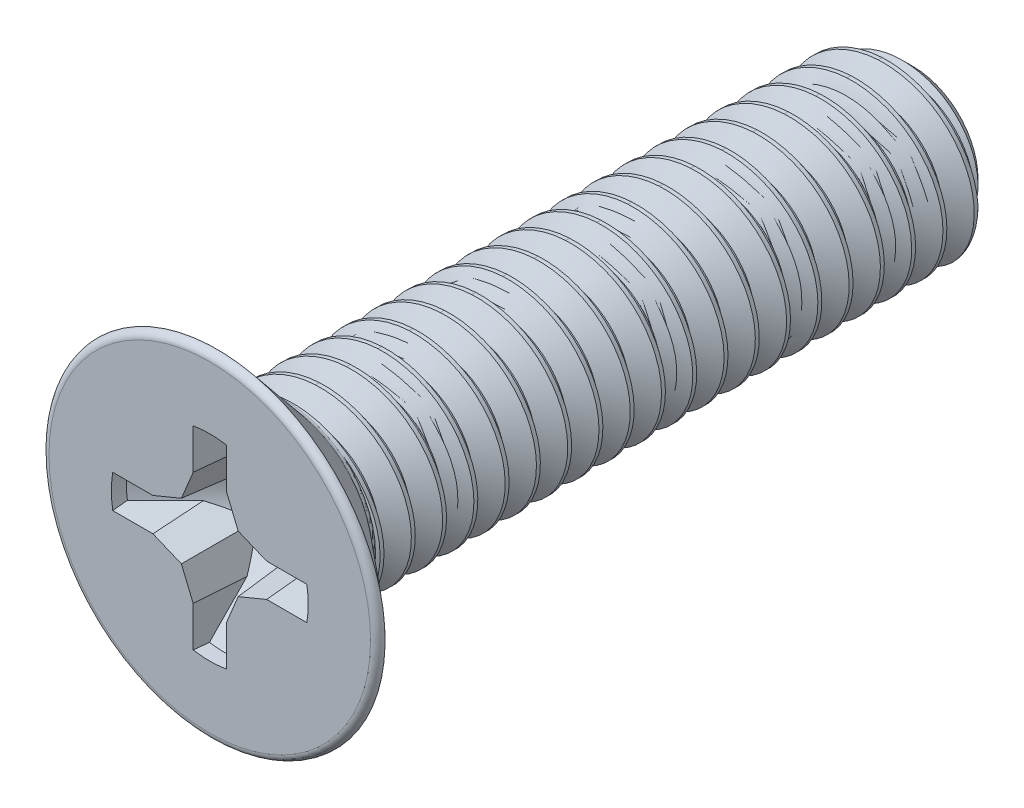
from build123d import *

# Parameters (mm, degrees)
SKETCH8_R          = 2.519891667
CUT_EXTRUDE2_DEPTH = 0.127
CUT_EXTRUDE2_DRAFT = -10
CUT_EXTRUDE1_REACH = 35.512
CIRPATTERN1_COUNT  = 4
DRAFT2_ANGLE       = 5
FILLET1_R          = 0.24844375
FILLET2_R          = 0.325326375
CUT_SWEEP1_PITCH   = 1.411111111
CUT_SWEEP1_TO      = 28.2448


with BuildPart() as part:
    # Sketch3 → Revolve1 (revolve)
    with BuildSketch(Plane(origin=(0, 0, 0), x_dir=(0, 0, -1), z_dir=(1, 0, 0)), mode=Mode.PRIVATE) as revolve1_sk:
        Polygon((-3.5052, 7.5819), (-3.5052, 0), (-0.15012295, 0), (-0.15012295, 3.9751), (-3.1765875, 7.5819), align=None)
    revolve(revolve1_sk.sketch.rotate(Axis((0, 0, 3.5052), (0, 0, -1)), 180), axis=Axis((0, 0, 3.5052), (0, 0, -1)))

    # Sketch5 → Revolve2 (revolve)
    with BuildSketch(Plane(origin=(0, 0, 0), x_dir=(0, 0, -1), z_dir=(1, 0, 0))):
        Polygon((28.2448, 0), (-0.15012295, 0), (-0.15012295, 3.9751), (27.186466667, 3.9751), (28.2448, 2.916766667), align=None)
    revolve(axis=Axis((0, 0, -28.2448), (0, 0, 1)))


with BuildPart() as cut_extrude2_tool:
    # Sketch8 → Cut-Extrude2 (with draft: the straight prism first)
    with BuildSketch(Plane(origin=(0, 0, -28.2448), x_dir=(-1, 0, 0), z_dir=(0, 0, -1))):
        Circle(SKETCH8_R)
    extrude(amount=-CUT_EXTRUDE2_DEPTH)
    # Cut-Extrude2: the draft: its side faces are tilted about the plane it starts from
    cut_extrude2_sides = [cut_extrude2_tool.faces().sort_by_distance(p)[0] for p in [
        (2.519891667, 0, -28.1813),
    ]]
    draft(cut_extrude2_sides, Plane(origin=(0, 0, -28.2448), x_dir=(-1, 0, 0), z_dir=(0, 0, -1)), CUT_EXTRUDE2_DRAFT)


with BuildPart() as part_1:
    add(part.part)

    # Cut-Extrude2: cut by cut_extrude2_tool
    add(cut_extrude2_tool.part, mode=Mode.SUBTRACT)

    # Cut-Extrude1: up to this cone (the profile starts inside it)
    cut_extrude1_end = Plane(origin=(0, 0, 3.5052), z_dir=(0, 0, 1)).offset(-4.402724178) * Cone(1.192e-06, 54.417481584, 45.661687727, align=(Align.CENTER, Align.CENTER, Align.MIN), mode=Mode.PRIVATE)
    # Sketch4 → Cut-Extrude1 (cut, up to the surface)
    with BuildSketch(Plane.XY.offset(3.5052), mode=Mode.PRIVATE) as cut_extrude1_sk1:
        with BuildLine():
            Line((0, 0), (4.445, 0))
            ThreePointArc((4.445, 0), (4.429068842, 0.375997599), (4.381389564, 0.7493))
            Line((4.381389564, 0.7493), (2.565344782, 0.7493))
            Line((2.565344782, 0.7493), (1.281207202, 1.281207202))
            Line((1.281207202, 1.281207202), (0.7493, 2.565344782))
            Line((0.7493, 2.565344782), (0.7493, 4.381389564))
            ThreePointArc((0.7493, 4.381389564), (0.375997599, 4.429068842), (0, 4.445))
            Line((0, 4.445), (0, 0))
        make_face()
    cut_extrude1_tool1 = extrude(cut_extrude1_sk1.sketch, amount=-CUT_EXTRUDE1_REACH, mode=Mode.PRIVATE) & cut_extrude1_end
    cut_extrude1 = cut_extrude1_tool1.solids().sort_by_distance((0.062862, 2.2225, 3.5052))[0]
    add(cut_extrude1, mode=Mode.SUBTRACT)

    # CirPattern1: Cut-Extrude1 ×4 about axis
    cirpattern1_axis = Axis((0, 0, 0), (0, 0, 1))
    for i in range(1, CIRPATTERN1_COUNT):
        add(cut_extrude1.rotate(cirpattern1_axis, i * 360 / CIRPATTERN1_COUNT), mode=Mode.SUBTRACT)

    # Draft2
    draft2_faces = [part_1.faces().sort_by_distance(p)[0] for p in [
        (-3.314723686, 0.7493, 2.730357163),
        (-1.892705762, 1.027916205, 2.216854354),
        (-1.027916205, 1.892705762, 2.216854354),
        (-0.7493, 3.314723686, 2.730357163),
        (0.7493, 3.314723686, 2.730357163),
        (1.027916205, 1.892705762, 2.216854354),
        (1.892705762, 1.027916205, 2.216854354),
        (3.314723686, 0.7493, 2.730357163),
        (3.314723686, -0.7493, 2.730357163),
        (1.892705762, -1.027916205, 2.216854354),
        (1.027916205, -1.892705762, 2.216854354),
        (0.7493, -3.314723686, 2.730357163),
        (-0.7493, -3.314723686, 2.730357163),
        (-1.027916205, -1.892705762, 2.216854354),
        (-1.892705762, -1.027916205, 2.216854354),
        (-3.314723686, -0.7493, 2.730357163),
    ]]
    draft(draft2_faces, Plane(origin=(0, 0, 3.5052), x_dir=(0, 1, 0), z_dir=(0, 0, 1)), DRAFT2_ANGLE)

    # Fillet1
    fillet1_edges = [part_1.edges().sort_by_distance(p)[0] for p in [
        (3.9751, 0, 0.15012295),
    ]]
    fillet(fillet1_edges, radius=FILLET1_R)

    # Fillet2
    fillet2_edges = [part_1.edges().sort_by_distance(p)[0] for p in [
        (0, 7.5819, 3.5052),
    ]]
    fillet(fillet2_edges, radius=FILLET2_R)


with BuildPart() as body_2:
    # Split1: the piece on the far side of the plane
    add(part_1.part)
    split(bisect_by=Plane(origin=(0, 0, 0), x_dir=(0, -1, 0), z_dir=(0, 0, -1)), keep=Keep.BOTTOM)


with BuildPart() as part_2:
    add(part_1.part)

    # Split1
    split(bisect_by=Plane(origin=(0, 0, 0), x_dir=(0, -1, 0), z_dir=(0, 0, -1)), keep=Keep.TOP)

    # Cut-Sweep1: arcs per turn and ends read off the stored shape
    # Cut-Sweep1: the profile of Sketch7 screwed along a right-hand helix through 22.5 turns, 8 arcs to a turn; built about Z, then put on its axis
    cut_sweep1_z = Axis((0, 0, 0), (0, 0, 1))
    cut_sweep1_corners = [(3.058556448, 0, -0.705555556), (3.058556448, 0, -0.529166667), (4.051478629, 0, 0.044097222), (4.051478629, 0, -1.278819444)]
    with BuildLine(mode=Mode.PRIVATE) as cut_sweep1_profile:
        Line(cut_sweep1_corners[0], cut_sweep1_corners[1])
        Line(cut_sweep1_corners[1], cut_sweep1_corners[2])
        Line(cut_sweep1_corners[2], cut_sweep1_corners[3])
        Line(cut_sweep1_corners[3], cut_sweep1_corners[0])
    cut_sweep1_cap = Face(cut_sweep1_profile.wire())
    cut_sweep1_turn_angles = [0, 22.5, 45, 67.5, 90, 112.5, 135, 157.5, 180, 202.5, 225, 247.5, 270, 292.5, 315, 337.5, 360]
    cut_sweep1_turn_weights = [1, 0.9238795325112867, 1, 0.9238795325112867, 1, 0.9238795325112867, 1, 0.9238795325112867, 1, 0.9238795325112867, 1, 0.9238795325112867, 1, 0.9238795325112867, 1, 0.9238795325112867, 1]
    cut_sweep1_turn_rails = [Edge.make_bspline([Vector(p[0], p[1], 0).rotate(cut_sweep1_z, cut_sweep1_turn_angles[k]) / cut_sweep1_turn_weights[k] + Vector(0, 0, p[2] + CUT_SWEEP1_PITCH * cut_sweep1_turn_angles[k] / 360) for k in range(17)], [0, 0, 0, 1, 1, 2, 2, 3, 3, 4, 4, 5, 5, 6, 6, 7, 7, 8, 8, 8], 2, cut_sweep1_turn_weights) for p in cut_sweep1_corners]
    cut_sweep1_turn_sides = [Face.make_surface_from_curves(cut_sweep1_turn_rails[p[0]], cut_sweep1_turn_rails[p[1]]) for p in [(0, 1), (1, 2), (2, 3), (3, 0)]]
    cut_sweep1_last_angles = [7920, 7942.5, 7965, 7987.5, 8010, 8032.5, 8055, 8077.5, 8100]
    cut_sweep1_last_weights = [1, 0.9238795325112867, 1, 0.9238795325112867, 1, 0.9238795325112867, 1, 0.9238795325117363, 1]
    cut_sweep1_last_rails = [Edge.make_bspline([Vector(p[0], p[1], 0).rotate(cut_sweep1_z, cut_sweep1_last_angles[k]) / cut_sweep1_last_weights[k] + Vector(0, 0, p[2] + CUT_SWEEP1_PITCH * cut_sweep1_last_angles[k] / 360) for k in range(9)], [0, 0, 0, 1, 1, 2, 2, 3, 3, 4, 4, 4], 2, cut_sweep1_last_weights) for p in cut_sweep1_corners]
    cut_sweep1_last_sides = [Face.make_surface_from_curves(cut_sweep1_last_rails[p[0]], cut_sweep1_last_rails[p[1]]) for p in [(0, 1), (1, 2), (2, 3), (3, 0)]]
    cut_sweep1 = Plane(origin=(0, 0, -28.2448), x_dir=(0, 1, 0), z_dir=(0, 0, 1)) * split(Solid(Shell([*[p.moved(Location((0, 0, CUT_SWEEP1_PITCH * i))) for i in range(22) for p in cut_sweep1_turn_sides], *cut_sweep1_last_sides, cut_sweep1_cap, cut_sweep1_cap.rotate(cut_sweep1_z, 8100).moved(Location((0, 0, CUT_SWEEP1_PITCH * 8100 / 360)))])), bisect_by=Plane.XY.offset(CUT_SWEEP1_TO), keep=Keep.BOTTOM, mode=Mode.PRIVATE)
    add(cut_sweep1, mode=Mode.SUBTRACT)


with BuildPart() as body_2_1:
    add(body_2.part)

    # Combine1: union part
    add(part_2.part)


solid = body_2_1.part
